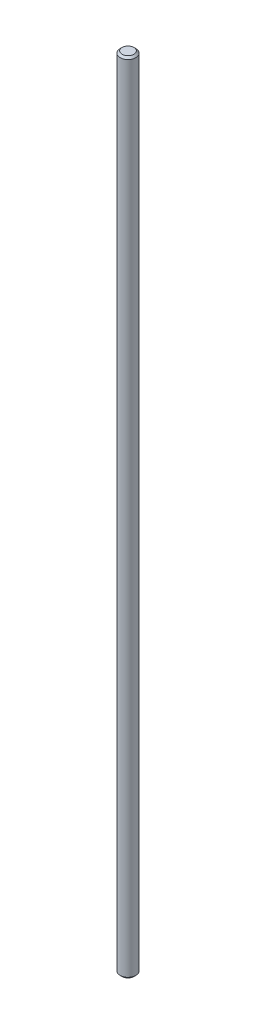
from build123d import *

# Parameters (mm, degrees)
SKETCH1_R           = 4
BOSS_EXTRUDE1_DEPTH = 405
CHAMFER1_SIZE       = 1


with BuildPart() as part:
    # Sketch1 → Boss-Extrude1 (new body)
    with BuildSketch(Plane(origin=(0, 0, 0), x_dir=(1, 0, 0), z_dir=(0, 1, 0))):
        Circle(SKETCH1_R)
    extrude(amount=BOSS_EXTRUDE1_DEPTH)

    # Chamfer1
    chamfer1_edges = [part.edges().sort_by_distance(p)[0] for p in [
        (-4, 405, 0),
        (-4, 0, 0),
    ]]
    chamfer(chamfer1_edges, length=CHAMFER1_SIZE)


solid = part.part
